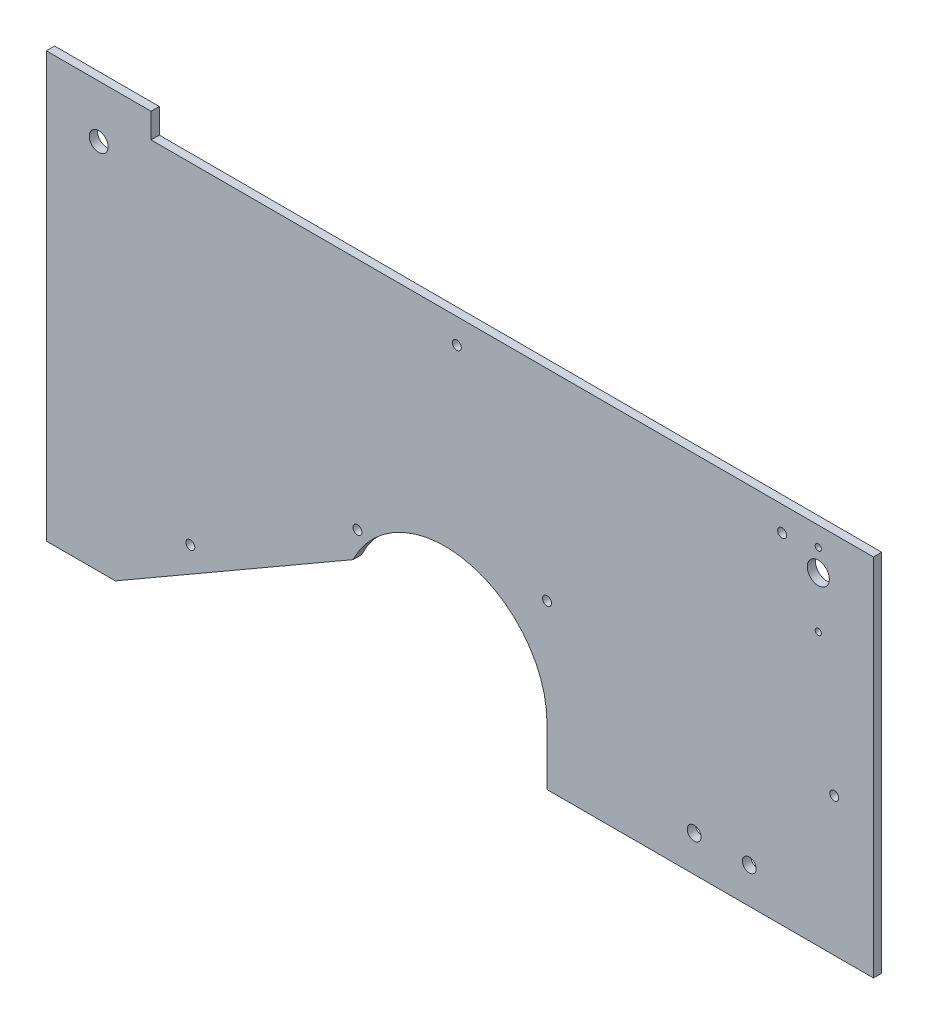
from build123d import *

# Parameters (mm, degrees)
SKETCH2_R           = 3.425
BOSS_EXTRUDE2_DEPTH = 3
SKETCH3_W           = 118.4
SKETCH3_H           = 12.75
CUT_EXTRUDE1_DEPTH  = 338.231374578
SKETCH5_R           = 2.5
SKETCH5_R_2         = 4
SKETCH5_R_3         = 1.125
SKETCH5_R_4         = 1.625
CUT_EXTRUDE2_DEPTH  = 338.231374578


with BuildPart() as part:
    # Sketch2 → Boss-Extrude2 (new body)
    with BuildSketch(Plane.XY):
        with BuildLine():
            Line((25.03035901, 0), (111.286489227, 49.8))
            ThreePointArc((111.286489227, 49.8), (152.858332199, 69.766604349), (181.6, 33.7))
            Line((181.6, 33.7), (181.6, 0))
            Line((181.6, 0), (300, 0))
            Line((300, 0), (300, 145))
            Line((300, 145), (38, 145))
            Line((38, 145), (38, 154))
            Line((38, 154), (19, 154))
            Line((19, 154), (0, 154))
            Line((0, 154), (0, 0))
            Line((0, 0), (25.03035901, 0))
        make_face()
        with Locations((19, 135)):
            Circle(SKETCH2_R, mode=Mode.SUBTRACT)
    extrude(amount=BOSS_EXTRUDE2_DEPTH)

    # Sketch3 → Cut-Extrude1 (cut, through all)
    with BuildSketch(Plane.XY.offset(3)):
        with Locations((240.8, 6.375)):
            Rectangle(SKETCH3_W, SKETCH3_H)
    extrude(amount=-CUT_EXTRUDE1_DEPTH, mode=Mode.SUBTRACT)

    # Sketch5 → Cut-Extrude2 (cut, through all)
    with BuildSketch(Plane.XY.offset(3)):
        with Locations((254.98, 25.75)):
            Circle(SKETCH5_R)
        with Locations((234.98, 25.75)):
            Circle(SKETCH5_R)
        with Locations((280, 130)):
            Circle(SKETCH5_R_2)
        with Locations((280, 138)):
            Circle(SKETCH5_R_3)
        with Locations((280, 111.5)):
            Circle(SKETCH5_R_3)
        with Locations((181.6, 72.03)):
            Circle(SKETCH5_R_4)
        with Locations((285.78, 62.92)):
            Circle(SKETCH5_R_4)
        with Locations((52.23, 24.91)):
            Circle(SKETCH5_R_4)
        with Locations((112.84, 59.93)):
            Circle(SKETCH5_R_4)
        with Locations((266.89, 135.99)):
            Circle(SKETCH5_R_4)
        with Locations((148.89, 135.99)):
            Circle(SKETCH5_R_4)
    extrude(amount=-CUT_EXTRUDE2_DEPTH, mode=Mode.SUBTRACT)


solid = part.part
